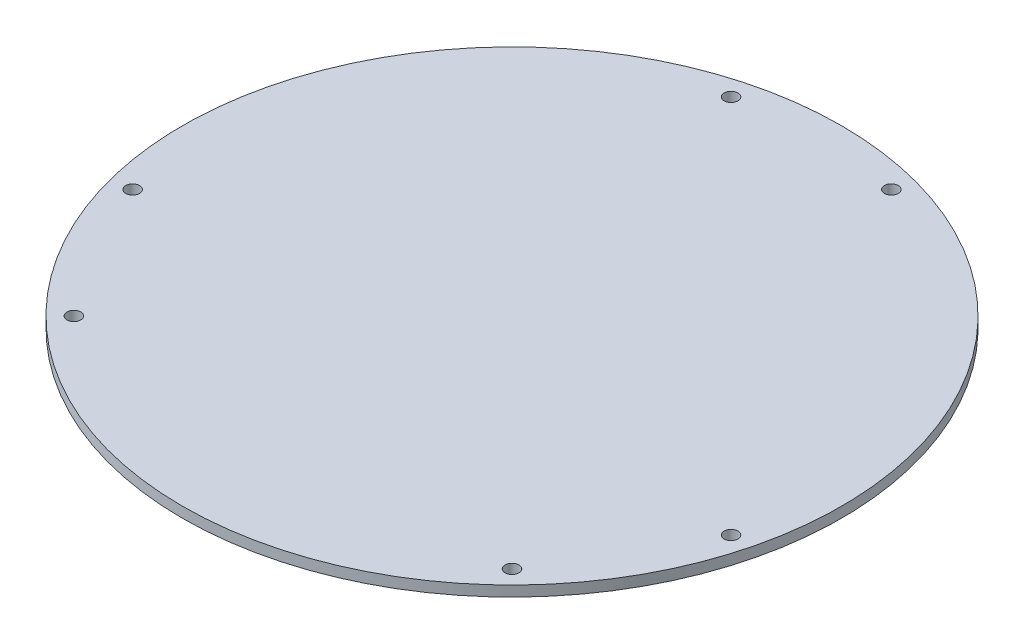
from build123d import *

# Parameters (mm, degrees)
SKETCH1_R           = 100
SKETCH1_R_2         = 2.1
BOSS_EXTRUDE1_DEPTH = 3.175


with BuildPart() as part:
    # Sketch1 → Boss-Extrude1 (new body)
    with BuildSketch(Plane(origin=(0, 0, 0), x_dir=(1, 0, 0), z_dir=(0, 1, 0))):
        Circle(SKETCH1_R)
        with Locations((24.32899024, 90.797027671)):
            Circle(SKETCH1_R_2, mode=Mode.SUBTRACT)
        with Locations((-24.32899024, 90.797027671)):
            Circle(SKETCH1_R_2, mode=Mode.SUBTRACT)
        with Locations((90.797027671, -24.32899024)):
            Circle(SKETCH1_R_2, mode=Mode.SUBTRACT)
        with Locations((66.468037432, -66.468037432)):
            Circle(SKETCH1_R_2, mode=Mode.SUBTRACT)
        with Locations((-66.468037432, -66.468037432)):
            Circle(SKETCH1_R_2, mode=Mode.SUBTRACT)
        with Locations((-90.797027671, -24.32899024)):
            Circle(SKETCH1_R_2, mode=Mode.SUBTRACT)
    extrude(amount=BOSS_EXTRUDE1_DEPTH)


solid = part.part
